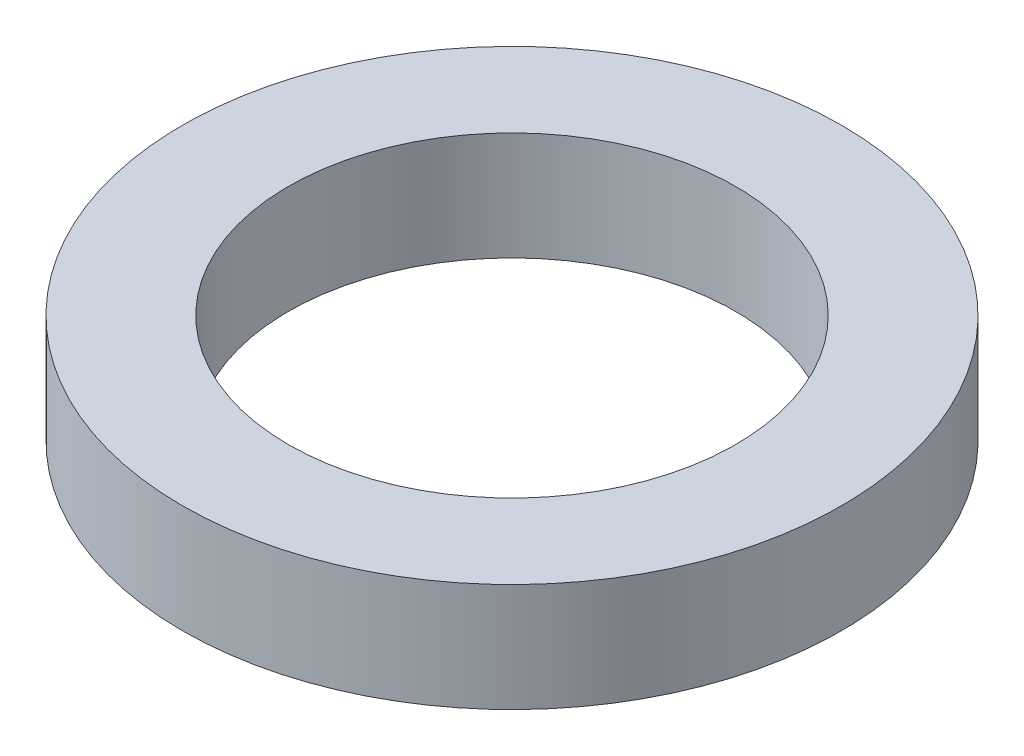
from build123d import *

# Parameters (mm, degrees)
SKETCH1_R           = 70
BOSS_EXTRUDE1_DEPTH = 23
SKETCH2_R           = 47.5
CUT_EXTRUDE1_DEPTH  = 102.631687972


with BuildPart() as part:
    # Sketch1 → Boss-Extrude1 (new body)
    with BuildSketch(Plane(origin=(0, 0, 0), x_dir=(1, 0, 0), z_dir=(0, 1, 0))):
        Circle(SKETCH1_R)
    extrude(amount=BOSS_EXTRUDE1_DEPTH)

    # Sketch2 → Cut-Extrude1 (cut, through all)
    with BuildSketch(Plane(origin=(0, 0, 0), x_dir=(1, 0, 0), z_dir=(0, 1, 0))):
        Circle(SKETCH2_R)
    extrude(amount=CUT_EXTRUDE1_DEPTH, mode=Mode.SUBTRACT)


solid = part.part
